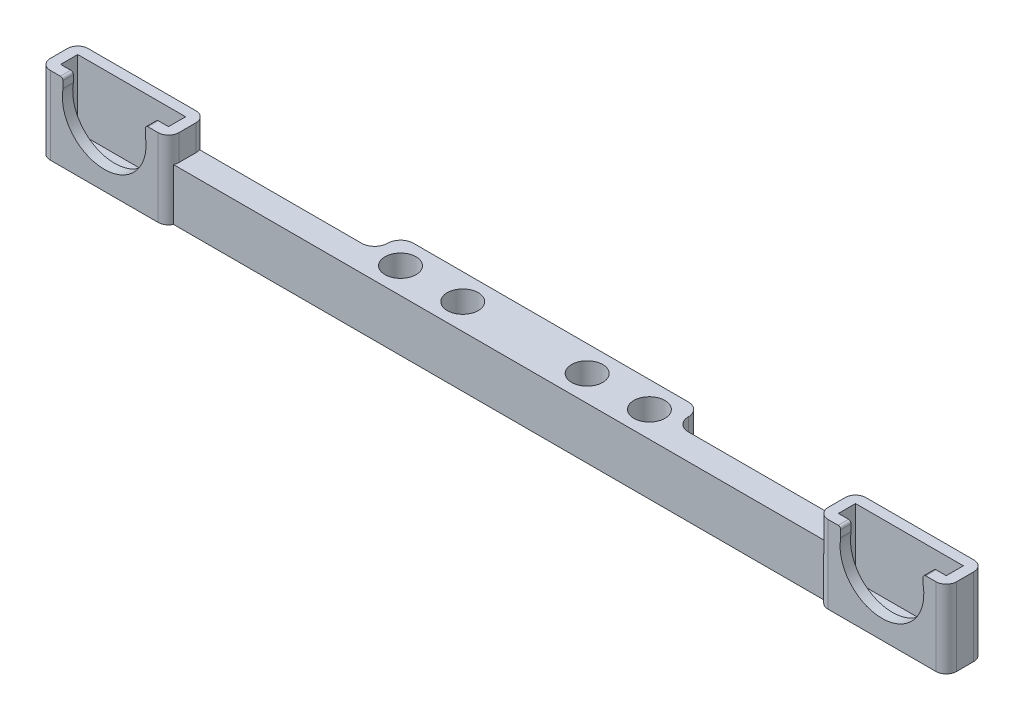
from build123d import *

# Parameters (mm, degrees)
SKIZZE1_W                                   = 29
SKIZZE1_H                                   = 10
SKIZZE1_R                                   = 3
AUFSATZ_LINEAR_AUSTRAGEN1_DEPTH             = 10
SKIZZE2_W                                   = 5
SKIZZE2_H                                   = 10
AUFSATZ_LINEAR_AUSTRAGEN2_DEPTH             = 57.25
SKIZZE3_W                                   = 20.8
SKIZZE3_H                                   = 3.3
SCHNITT_LINEAR_AUSTRAGEN1_DEPTH             = 8
AUFSATZ_LINEAR_AUSTRAGEN3_REACH             = 88.972
SKIZZE5_W                                   = 24.8
SKIZZE5_H                                   = 7.3
SKIZZE5_W_2                                 = 20.8
SKIZZE5_H_2                                 = 3.3
AUFSATZ_LINEAR_AUSTRAGEN3_DIRECTION_2_DEPTH = 5
SCHNITT_LINEAR_AUSTRAGEN2_REACH             = 91.376
SKIZZE4_R                                   = 8.075
SCHNITT_LINEAR_START                        = -1.834682
SKIZZE7_W                                   = 15.9
SKIZZE7_H                                   = 2
SCHNITT_LINEAR_AUSTRAGEN3_DEPTH             = 1.834682
VERRUNDUNG1_R                               = 2
VERRUNDUNG3_R                               = 0.5
VERRUNDUNG1_OF_SPIEGELN1_R                  = 2
VERRUNDUNG3_OF_SPIEGELN1_R                  = 0.5
VERRUNDUNG2_START                           = -1
VERRUNDUNG2_DEPTH                           = 12
VERRUNDUNG2_2_DEPTH                         = 10


with BuildPart() as part:
    # Skizze1 → Aufsatz-Linear austragen1 (new body)
    # profile 1 of 2: a face of its own
    with BuildSketch(Plane(origin=(0, 0, 0), x_dir=(1, 0, 0), z_dir=(0, 1, 0))):
        with Locations((-14.5, 0)):
            Rectangle(SKIZZE1_W, SKIZZE1_H)
        with Locations(Location((-24, 0, 0), (0, 0, 270))):
            Circle(SKIZZE1_R, mode=Mode.SUBTRACT)
        with Locations(Location((-12, 0, 0), (0, 0, 270))):
            Circle(SKIZZE1_R, mode=Mode.SUBTRACT)
    # profile 2 of 2: a face of its own
    with BuildSketch(Plane(origin=(0, 0, 0), x_dir=(1, 0, 0), z_dir=(0, 1, 0))):
        with Locations((14.5, 0)):
            Rectangle(SKIZZE1_W, SKIZZE1_H)
        with Locations(Location((12, 0, 0), (0, 0, 270))):
            Circle(SKIZZE1_R, mode=Mode.SUBTRACT)
        with Locations(Location((24, 0, 0), (0, 0, 270))):
            Circle(SKIZZE1_R, mode=Mode.SUBTRACT)
    extrude(amount=AUFSATZ_LINEAR_AUSTRAGEN1_DEPTH)

    # Skizze2 → Aufsatz-Linear austragen2 (add)
    with BuildSketch(Plane(origin=(29, 0, 0), x_dir=(0, 0, -1), z_dir=(1, 0, 0))):
        with Locations((-2.5, 5)):
            Rectangle(SKIZZE2_W, SKIZZE2_H)
    aufsatz_linear_austragen2 = extrude(amount=AUFSATZ_LINEAR_AUSTRAGEN2_DEPTH)

    # Skizze3 → Schnitt-Linear austragen1 (cut)
    with BuildSketch(Plane(origin=(0, 10, 0), x_dir=(1, 0, 0), z_dir=(0, 1, 0))):
        with Locations((75, -2.5)):
            Rectangle(SKIZZE3_W, SKIZZE3_H)
    schnitt_linear_austragen1 = extrude(amount=-SCHNITT_LINEAR_AUSTRAGEN1_DEPTH, mode=Mode.SUBTRACT)

    # Aufsatz-Linear austragen3: up to this face of the body (flat: up to its plane)
    aufsatz_linear_austragen3_end = Plane(part.part.faces().sort_by_distance((28.625, 0, 3.84316974))[0])
    # Skizze5 → Aufsatz-Linear austragen3 (add, up to the picked face)
    with BuildSketch(Plane(origin=(0, 10, 0), x_dir=(1, 0, 0), z_dir=(0, 1, 0)), mode=Mode.PRIVATE) as aufsatz_linear_austragen3_sk1:
        with Locations((75, -2.5)):
            Rectangle(SKIZZE5_W, SKIZZE5_H)
        with Locations((75, -2.5)):
            Rectangle(SKIZZE5_W_2, SKIZZE5_H_2, mode=Mode.SUBTRACT)
    aufsatz_linear_austragen3_tool1 = split(extrude(aufsatz_linear_austragen3_sk1.sketch, amount=-AUFSATZ_LINEAR_AUSTRAGEN3_REACH, mode=Mode.PRIVATE), bisect_by=aufsatz_linear_austragen3_end, keep=Keep.BOTH, mode=Mode.PRIVATE)
    aufsatz_linear_austragen3 = aufsatz_linear_austragen3_tool1.solids().sort_by(Axis((75, 10, 5.891479), (0, -1, 0)))[0]
    add(aufsatz_linear_austragen3)

    # Skizze5 → Aufsatz-Linear austragen3 direction 2 (add)
    with BuildSketch(Plane(origin=(0, 10, 0), x_dir=(1, 0, 0), z_dir=(0, 1, 0))):
        with Locations((75, -2.5)):
            Rectangle(SKIZZE5_W, SKIZZE5_H)
        with Locations((75, -2.5)):
            Rectangle(SKIZZE5_W_2, SKIZZE5_H_2, mode=Mode.SUBTRACT)
    aufsatz_linear_austragen3_direction_2 = extrude(amount=AUFSATZ_LINEAR_AUSTRAGEN3_DIRECTION_2_DEPTH)

    # Skizze4 → Schnitt-Linear austragen2 (cut, up to next)
    with BuildSketch(Plane.XY.offset(6.15), mode=Mode.PRIVATE) as schnitt_linear_austragen2_sk1:
        with Locations((75, 11.75)):
            Circle(SKIZZE4_R)
    schnitt_linear_austragen2_tool1 = extrude(schnitt_linear_austragen2_sk1.sketch, amount=-SCHNITT_LINEAR_AUSTRAGEN2_REACH, mode=Mode.PRIVATE) & part.part
    schnitt_linear_austragen2 = schnitt_linear_austragen2_tool1.solids().sort_by_distance((75, 11.75, 6.15))[0]
    add(schnitt_linear_austragen2, mode=Mode.SUBTRACT)

    # Skizze7 → Schnitt-Linear austragen3 (cut)
    with BuildSketch(Plane(origin=(0, 15, 0), x_dir=(1, 0, 0), z_dir=(0, 1, 0)).offset(SCHNITT_LINEAR_START)):
        with Locations((75, -5.15)):
            Rectangle(SKIZZE7_W, SKIZZE7_H)
    schnitt_linear_austragen3 = extrude(amount=SCHNITT_LINEAR_AUSTRAGEN3_DEPTH, mode=Mode.SUBTRACT)

    # Verrundung1
    verrundung1_edges = [part.edges().sort_by_distance(p)[0] for p in [
        (87.4, 7.5, 6.15),
        (87.4, 7.5, -1.15),
        (62.6, 7.5, 6.15),
        (62.6, 7.5, -1.15),
    ]]
    fillet(verrundung1_edges, radius=VERRUNDUNG1_R)

    # Verrundung3
    verrundung3_edges = [part.edges().sort_by_distance(p)[0] for p in [
        (82.95, 15, 5.15),
        (82.95, 13.165318, 5.15),
        (67.05, 15, 5.15),
        (67.05, 13.165318, 5.15),
    ]]
    fillet(verrundung3_edges, radius=VERRUNDUNG3_R)

    # Spiegeln1: Aufsatz-Linear austragen2, Schnitt-Linear austragen1, Aufsatz-Linear austragen3, Aufsatz-Linear austragen3 direction 2, Schnitt-Linear austragen2, Schnitt-Linear austragen3 across plane
    add(aufsatz_linear_austragen2.mirror(Plane(origin=(0, 0, 0), x_dir=(0, 0, 1), z_dir=(1, 0, 0))))
    add(schnitt_linear_austragen1.mirror(Plane(origin=(0, 0, 0), x_dir=(0, 0, 1), z_dir=(1, 0, 0))), mode=Mode.SUBTRACT)
    add(aufsatz_linear_austragen3.mirror(Plane(origin=(0, 0, 0), x_dir=(0, 0, 1), z_dir=(1, 0, 0))))
    add(aufsatz_linear_austragen3_direction_2.mirror(Plane(origin=(0, 0, 0), x_dir=(0, 0, 1), z_dir=(1, 0, 0))))
    add(schnitt_linear_austragen2.mirror(Plane(origin=(0, 0, 0), x_dir=(0, 0, 1), z_dir=(1, 0, 0))), mode=Mode.SUBTRACT)
    add(schnitt_linear_austragen3.mirror(Plane(origin=(0, 0, 0), x_dir=(0, 0, 1), z_dir=(1, 0, 0))), mode=Mode.SUBTRACT)

    # Verrundung1 of Spiegeln1
    verrundung1_of_spiegeln1_edges = [part.edges().sort_by_distance(p)[0] for p in [
        (-87.4, 7.5, 6.15),
        (-87.4, 7.5, -1.15),
        (-62.6, 7.5, 6.15),
        (-62.6, 7.5, -1.15),
    ]]
    fillet(verrundung1_of_spiegeln1_edges, radius=VERRUNDUNG1_OF_SPIEGELN1_R)

    # Verrundung3 of Spiegeln1
    verrundung3_of_spiegeln1_edges = [part.edges().sort_by_distance(p)[0] for p in [
        (-82.95, 15, 5.15),
        (-82.95, 13.165318, 5.15),
        (-67.05, 15, 5.15),
        (-67.05, 13.165318, 5.15),
    ]]
    fillet(verrundung3_of_spiegeln1_edges, radius=VERRUNDUNG3_OF_SPIEGELN1_R)

    # Verrundung2: read off the stored shape, not the designer's step
    # Verrundung2 outline → Verrundung2 (cut)
    with BuildSketch(Plane(origin=(0, 0, 0), x_dir=(1, 0, 0), z_dir=(0, 1, 0)).offset(VERRUNDUNG2_START)):
        with BuildLine():
            ThreePointArc((-29, 2.5), (-28.267766953, 4.267766953), (-26.5, 5))
            Line((-26.5, 5), (-29, 5))
            Line((-29, 5), (-29, 2.5))
        make_face()
        with BuildLine():
            ThreePointArc((26.5, 5), (28.267766953, 4.267766953), (29, 2.5))
            Line((29, 2.5), (29, 5))
            Line((29, 5), (26.5, 5))
        make_face()
    extrude(amount=VERRUNDUNG2_DEPTH, mode=Mode.SUBTRACT)

    # Verrundung2 2 outline → Verrundung2 2 (add)
    with BuildSketch(Plane(origin=(0, 0, 0), x_dir=(1, 0, 0), z_dir=(0, 1, 0))):
        with BuildLine():
            Line((-29, 0), (-29, 2.5))
            ThreePointArc((-29, 2.5), (-29.732233047, 0.732233047), (-31.5, 0))
            Line((-31.5, 0), (-29, 0))
        make_face()
        with BuildLine():
            ThreePointArc((31.5, 0), (29.732233047, 0.732233047), (29, 2.5))
            Line((29, 2.5), (29, 0))
            Line((29, 0), (31.5, 0))
        make_face()
    extrude(amount=VERRUNDUNG2_2_DEPTH)


solid = part.part
